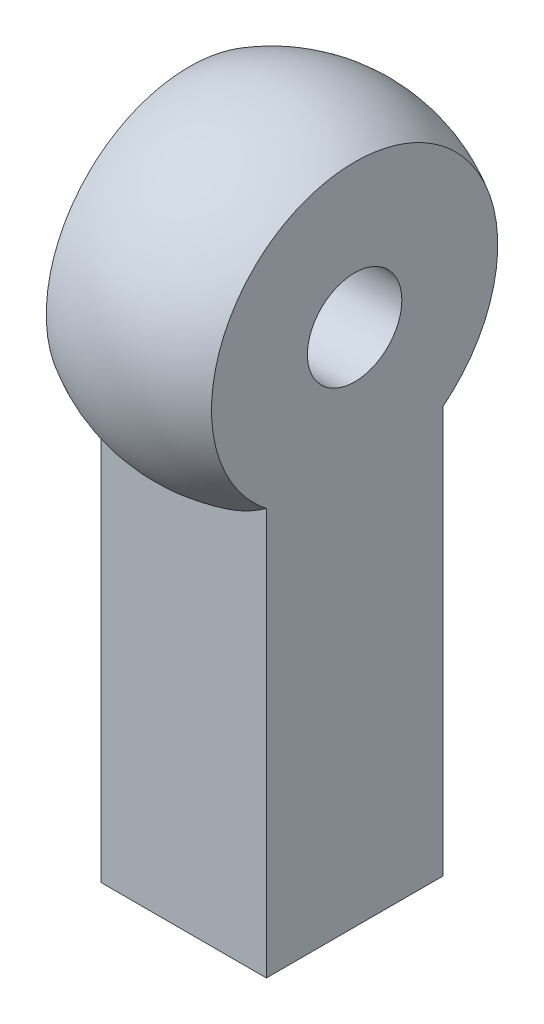
from build123d import *

# Parameters (mm, degrees)
CUT_EXTRUDE_START        = -6.062177826
CUT_EXTRUDE_1_OUTLINE_W  = 4.5
CUT_EXTRUDE_1_OUTLINE_H  = 16
CUT_EXTRUDE_1_DEPTH      = 12.124355652
CUT_EXTRUDE_2_DEPTH      = 15.43086969
CUT_EXTRUDE_2_DEPTH_BACK = 15.43086969
SKETCH_3_R               = 2
SKETCH_4_W               = 7.475945476
SKETCH_4_H               = 17.759961534
EXTRUDE_1_DEPTH          = 7
SKETCH_5_R               = 2
CUT_EXTRUDE_3_DEPTH      = 15


# Read off the part's stored shape, not the designer's step: 切除-拉伸1
with BuildPart() as part:
    # 草图1 → 旋转1 (revolve)
    with BuildSketch(Plane(origin=(0, 0, 0), x_dir=(0, 0, -1), z_dir=(1, 0, 0))):
        with BuildLine():
            Line((0, 7), (0, -7))
            ThreePointArc((0, -7), (-7, 0), (0, 7))
        make_face()
    revolve(axis=Axis((0, 7, 0), (0, -1, 0)))

    # 切除-拉伸1 outline → 切除-拉伸1 (cut)
    with BuildSketch(Plane.XY.offset(CUT_EXTRUDE_START)):
        with Locations((-5.75, 0)):
            Rectangle(CUT_EXTRUDE_1_OUTLINE_W, CUT_EXTRUDE_1_OUTLINE_H)
        with Locations((5.75, 0)):
            Rectangle(CUT_EXTRUDE_1_OUTLINE_W, CUT_EXTRUDE_1_OUTLINE_H)
    extrude(amount=CUT_EXTRUDE_1_DEPTH, mode=Mode.SUBTRACT)

    # 草图3 → 切除-拉伸2 (cut, two sides: drawn at the far end of the back side and taken through both)
    with BuildSketch(Plane(origin=(3.5, 0, 0), x_dir=(0, 0, -1), z_dir=(1, 0, 0)).offset(-CUT_EXTRUDE_2_DEPTH_BACK)):
        Circle(SKETCH_3_R)
    extrude(amount=CUT_EXTRUDE_2_DEPTH + CUT_EXTRUDE_2_DEPTH_BACK, mode=Mode.SUBTRACT)

    # 草图4 → 凸台-拉伸1 (add)
    with BuildSketch(Plane(origin=(3.5, 0, 0), x_dir=(0, 0, -1), z_dir=(1, 0, 0))):
        with Locations((0, -13.120019233)):
            Rectangle(SKETCH_4_W, SKETCH_4_H)
    extrude(amount=-EXTRUDE_1_DEPTH)

    # 草图5 → 切除-拉伸3 (cut)
    with BuildSketch(Plane.XZ.offset(22)):
        with Locations(Location((0, 0, 0), (0, 0, 270))):
            Circle(SKETCH_5_R)
    extrude(amount=-CUT_EXTRUDE_3_DEPTH, mode=Mode.SUBTRACT)


solid = part.part
